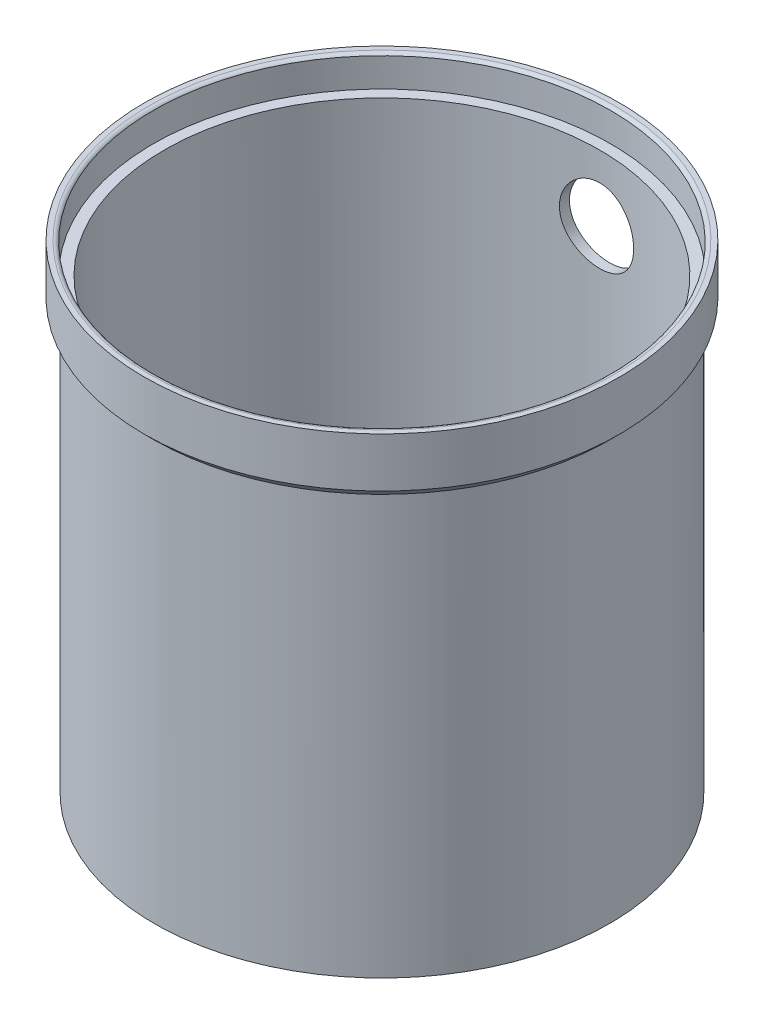
from build123d import *
from build123d.topology import SkipClean

# Parameters (mm, degrees)
SKETCH1_R                = 36.8
SKETCH1_R_2              = 35.2
BOSS_EXTRUDE1_DEPTH      = 70
BOSS_EXTRUDE2_DEPTH      = 5
BOSS_EXTRUDE2_DEPTH_BACK = 5
SKETCH2_R                = 38.4
SKETCH2_R_2              = 36.8
CHAMFER1_SIZE            = 2
FILLET1_R                = 0.8
BOSS_EXTRUDE3_START      = 2.3
SKETCH3_R                = 36.8
SKETCH3_R_2              = 36.2
BOSS_EXTRUDE3_DEPTH      = 2.3
CHAMFER2_SIZE            = 1
SKETCH5_R                = 36.95
CUT_EXTRUDE1_DEPTH       = 10
SKETCH6_R                = 6
CUT_EXTRUDE2_DEPTH       = 10


# Some blends are built 0.0001 mm under size
with BuildPart() as part:
    # Sketch1 → Boss-Extrude1 (new body)
    with BuildSketch(Plane(origin=(0, 0, 0), x_dir=(1, 0, 0), z_dir=(0, 1, 0))):
        with Locations(Location((0, 0, 0), (0, 0, 270))):
            Circle(SKETCH1_R)
        with Locations(Location((0, 0, 0), (0, 0, 270))):
            Circle(SKETCH1_R_2, mode=Mode.SUBTRACT)
    extrude(amount=BOSS_EXTRUDE1_DEPTH)

    # Sketch2 → Boss-Extrude2 (add, two sides: drawn at the far end of the back side and taken through both)
    with BuildSketch(Plane(origin=(0, 70, 0), x_dir=(1, 0, 0), z_dir=(0, 1, 0)).offset(-BOSS_EXTRUDE2_DEPTH_BACK)):
        with Locations(Location((0, 0, 0), (0, 0, 270))):
            Circle(SKETCH2_R)
        with Locations(Location((0, 0, 0), (0, 0, 270))):
            Circle(SKETCH2_R_2, mode=Mode.SUBTRACT)
    extrude(amount=BOSS_EXTRUDE2_DEPTH + BOSS_EXTRUDE2_DEPTH_BACK)

    # Chamfer1
    # the kernel refuses this chamfer: 2 mm, written as the material it takes off along each edge
    with BuildSketch(Plane(origin=(0, 65, 0), x_dir=(0, 0, 1), z_dir=(-1, 0, 0))) as chamfer1_piece_1_section:
        Polygon((38.4 - CHAMFER1_SIZE, 0), (38.4, CHAMFER1_SIZE), (38.4, 0), align=None)
    chamfer1_piece_1 = revolve(axis=Axis((0, 65, 0), (0, 1, 0)), mode=Mode.PRIVATE)
    chamfer1_piece_1 = chamfer1_piece_1 - Plane(origin=(0, 66.172330508, 0), x_dir=(0, 0, 1), z_dir=(0, -1, 0)) * Cylinder(36.8, 154, mode=Mode.PRIVATE)
    add(chamfer1_piece_1, mode=Mode.SUBTRACT)

    # Fillet1
    fillet1_edges = [part.edges().sort_by_distance(p)[0] for p in [
        (0, 75, -36.8),
    ]]
    fillet(fillet1_edges, radius=FILLET1_R)

    # Sketch3 → Boss-Extrude3 (add)
    with BuildSketch(Plane.XZ.offset(BOSS_EXTRUDE3_START)):
        with Locations(Location((0, 0, 0), (0, 0, 270))):
            Circle(SKETCH3_R)
        with Locations(Location((0, 0, 0), (0, 0, 270))):
            Circle(SKETCH3_R_2, mode=Mode.SUBTRACT)
    extrude(amount=-BOSS_EXTRUDE3_DEPTH)

    # Chamfer2
    chamfer2_edges = [part.edges().sort_by_distance(p)[0] for p in [
        (0, 0, -35.2),
    ]]
    chamfer(chamfer2_edges, length=CHAMFER2_SIZE - 0.0001)  # a hair under: the kernel refuses the full size

    # Sketch5 → Cut-Extrude1 (cut)
    with BuildSketch(Plane(origin=(0, 70, 0), x_dir=(1, 0, 0), z_dir=(0, 1, 0))):
        with Locations(Location((0, 0, 0), (0, 0, 270))):
            Circle(SKETCH5_R)
    extrude(amount=CUT_EXTRUDE1_DEPTH, mode=Mode.SUBTRACT)

    # Sketch6 → Cut-Extrude2 (cut)
    with SkipClean():  # the faces are left unmerged after this step: merging them gives an invalid solid
        with BuildSketch(Plane(origin=(0, 0, -36.8), x_dir=(-1, 0, 0), z_dir=(0, 0, -1))):
            with Locations(Location((0, 59.4, 0), (0, 0, 90))):
                Circle(SKETCH6_R)
        extrude(amount=-CUT_EXTRUDE2_DEPTH, mode=Mode.SUBTRACT)


solid = part.part
